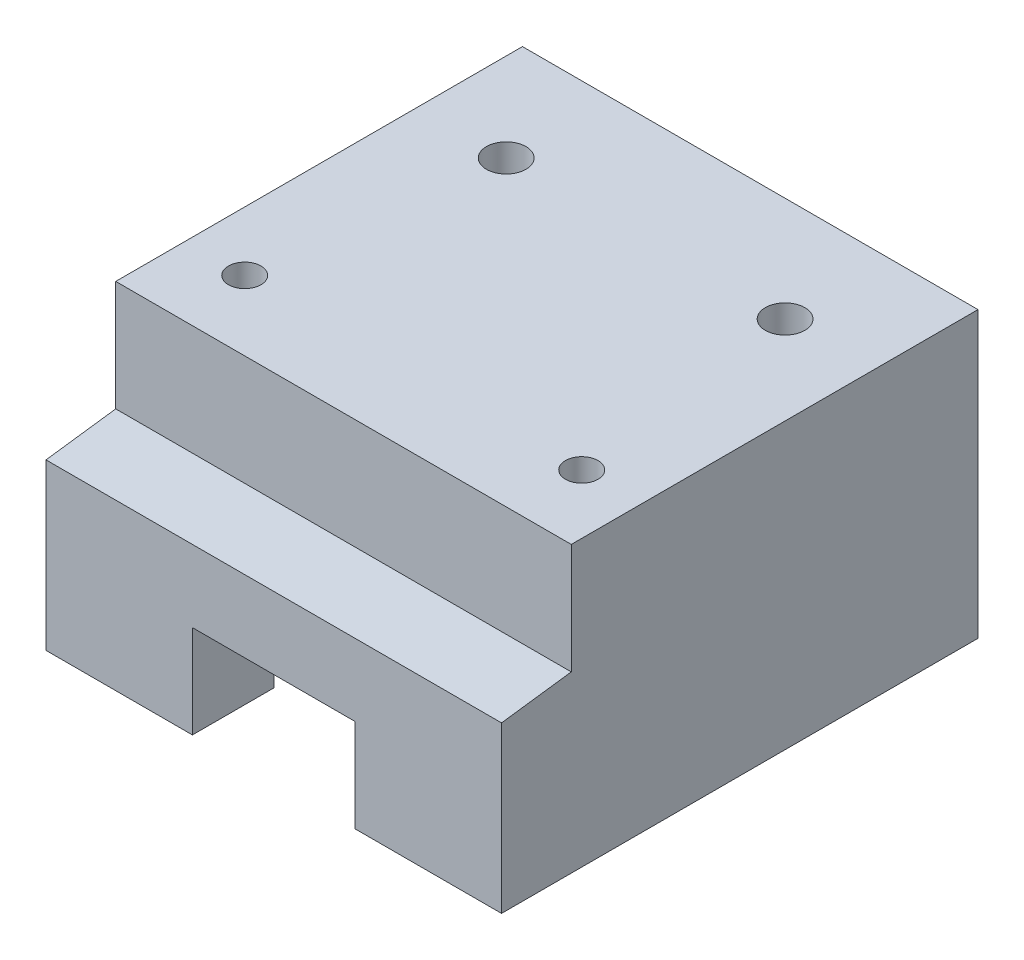
from build123d import *

# Parameters (mm, degrees)
SKETCH_1_W          = 40
SKETCH_1_H          = 20
EXTRUDE_1_DEPTH     = 6
SKETCH_2_W          = 40
SKETCH_2_H          = 32.5
EXTRUDE_2_DEPTH     = 35
CUT_EXTRUDE_1_DEPTH = 13
CUT_EXTRUDE_2_DEPTH = 2
SKETCH_6_W          = 40
SKETCH_6_H          = 41
CUT_EXTRUDE_3_DEPTH = 5
SKETCH_8_R          = 1.7
SKETCH_8_R_2        = 1.4
CUT_EXTRUDE_4_DEPTH = 49.79805324
CUT_EXTRUDE_5_REACH = 48.165
SKETCH_9_W          = 40
SKETCH_9_H          = 3
CHAMFER_1_SIZE2     = 6
CHAMFER_1_SIZE      = 0.8
CUT_EXTRUDE_6_REACH = 49.173
SKETCH_11_W         = 0.4
SKETCH_11_H         = 41


with BuildPart() as part:
    # Эскиз1 → Бобышка-Вытянуть1 (new body)
    with BuildSketch(Plane.XY):
        Rectangle(SKETCH_1_W, SKETCH_1_H)
    extrude(amount=EXTRUDE_1_DEPTH)

    # Эскиз2 → Бобышка-Вытянуть2 (add)
    with BuildSketch(Plane(origin=(0, 0, 0), x_dir=(-1, 0, 0), z_dir=(0, 0, -1))):
        with Locations((0, 6.25)):
            Rectangle(SKETCH_2_W, SKETCH_2_H)
    extrude(amount=EXTRUDE_2_DEPTH)

    # Эскиз3 → Вырез-Вытянуть1 (cut)
    with BuildSketch(Plane.XZ.offset(10)):
        Polygon((-7, 6), (-7, -1), (-9, -1), (-9, -23), (-6.5, -26), (-6.5, -33), (-4.5, -33), (-4.5, -35), (4.5, -35), (4.5, -33), (6.5, -33), (6.5, -26), (9, -23), (9, -1), (7, -1), (7, 6), align=None)
    extrude(amount=-CUT_EXTRUDE_1_DEPTH, mode=Mode.SUBTRACT)

    # Эскиз5 → Вырез-Вытянуть2 (cut)
    with BuildSketch(Plane.XZ.offset(-3)):
        Polygon((-9, -1), (9, -1), (9, -23), (6.5, -26), (6.5, -33), (-6.5, -33), (-6.5, -26), (-9, -23), align=None)
    extrude(amount=-CUT_EXTRUDE_2_DEPTH, mode=Mode.SUBTRACT)

    # Эскиз6 → Вырез-Вытянуть3 (cut)
    with BuildSketch(Plane.XZ.offset(10)):
        with Locations((0, -14.5)):
            Rectangle(SKETCH_6_W, SKETCH_6_H)
    extrude(amount=-CUT_EXTRUDE_3_DEPTH, mode=Mode.SUBTRACT)

    # Эскиз8 → Вырез-Вытянуть4 (cut, through all)
    with BuildSketch(Plane.XZ.offset(5)):
        with Locations((12, -26)):
            Circle(SKETCH_8_R)
        with Locations((14.5, -6)):
            Circle(SKETCH_8_R_2)
        with Locations(Location((-12, -26, 0), (0, 0, 180))):
            Circle(SKETCH_8_R)
        with Locations(Location((-14.5, -6, 0), (0, 0, 180))):
            Circle(SKETCH_8_R_2)
    extrude(amount=-CUT_EXTRUDE_4_DEPTH, mode=Mode.SUBTRACT)

    # Вырез-Вытянуть5: up to this face of the body (flat: up to its plane)
    cut_extrude_5_end = Plane(part.part.faces().sort_by_distance((0, 9.432879377, -35))[0])
    # Эскиз9 → Вырез-Вытянуть5 (cut, up to the picked face)
    with BuildSketch(Plane.XY, mode=Mode.PRIVATE) as cut_extrude_5_sk1:
        with Locations((0, 21)):
            Rectangle(SKETCH_9_W, SKETCH_9_H)
    cut_extrude_5_tool1 = split(extrude(cut_extrude_5_sk1.sketch, amount=-CUT_EXTRUDE_5_REACH, mode=Mode.PRIVATE), bisect_by=cut_extrude_5_end, keep=Keep.BOTH, mode=Mode.PRIVATE)
    add(cut_extrude_5_tool1.solids().sort_by(Axis((0, 21, 0), (0, 0, -1)))[0], mode=Mode.SUBTRACT)

    # Фаска1
    chamfer_1_edges = [part.edges().sort_by_distance(p)[0] for p in [
        (0, 10, 6),
    ]]
    chamfer_1_side = [part.faces().sort_by_distance(p)[0] for p in [
        (0, 9.984, 6),
    ]]
    chamfer(chamfer_1_edges, length=CHAMFER_1_SIZE - 0.0001, length2=CHAMFER_1_SIZE2 - 0.0001, reference=chamfer_1_side[0])  # a hair under: the kernel refuses the full size

    # Вырез-Вытянуть6: up to this face of the body (flat: up to its plane)
    cut_extrude_6_end = Plane(part.part.faces().sort_by_distance((13.916834893, -5, -14.890204003))[0])
    # Эскиз11 → Вырез-Вытянуть6 (cut, up to the picked face)
    with BuildSketch(Plane(origin=(0, 19.5, 0), x_dir=(1, 0, 0), z_dir=(0, 1, 0)), mode=Mode.PRIVATE) as cut_extrude_6_sk1:
        with Locations((-19.8, 14.5)):
            Rectangle(SKETCH_11_W, SKETCH_11_H)
    cut_extrude_6_tool1 = split(extrude(cut_extrude_6_sk1.sketch, amount=-CUT_EXTRUDE_6_REACH, mode=Mode.PRIVATE), bisect_by=cut_extrude_6_end, keep=Keep.BOTH, mode=Mode.PRIVATE)
    # Эскиз11 → Вырез-Вытянуть6 (cut, up to the picked face)
    with BuildSketch(Plane(origin=(0, 19.5, 0), x_dir=(1, 0, 0), z_dir=(0, 1, 0)), mode=Mode.PRIVATE) as cut_extrude_6_sk2:
        with Locations((19.8, 14.5)):
            Rectangle(SKETCH_11_W, SKETCH_11_H)
    cut_extrude_6_tool2 = split(extrude(cut_extrude_6_sk2.sketch, amount=-CUT_EXTRUDE_6_REACH, mode=Mode.PRIVATE), bisect_by=cut_extrude_6_end, keep=Keep.BOTH, mode=Mode.PRIVATE)
    add(cut_extrude_6_tool1.solids().sort_by(Axis((-19.8, 19.5, -14.5), (0, -1, 0)))[0], mode=Mode.SUBTRACT)
    add(cut_extrude_6_tool2.solids().sort_by(Axis((19.8, 19.5, -14.5), (0, -1, 0)))[0], mode=Mode.SUBTRACT)


solid = part.part
